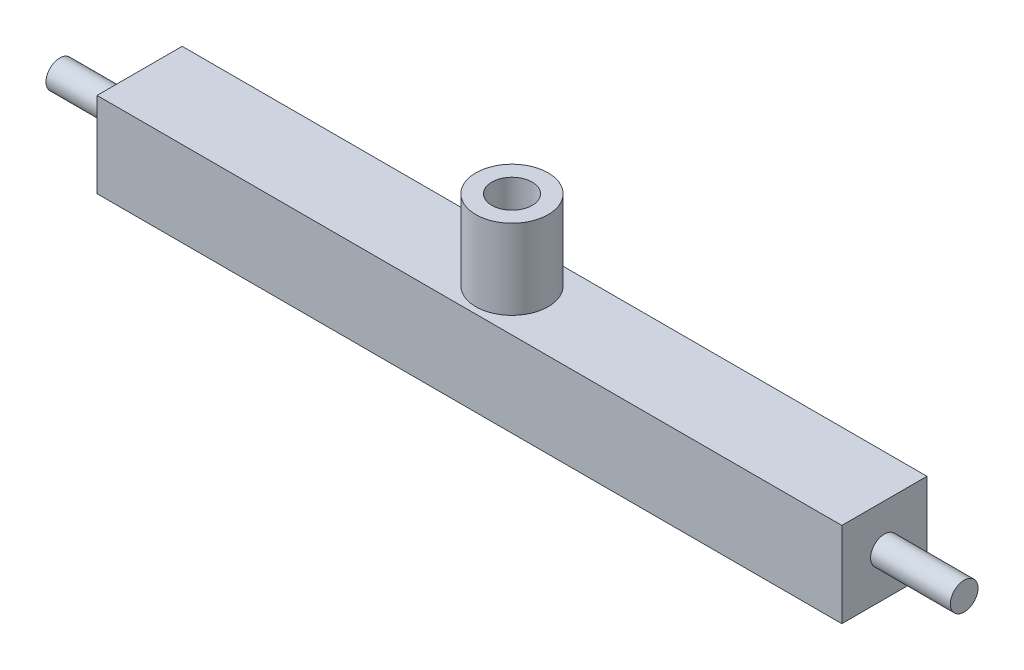
from build123d import *

# Parameters (mm, degrees)
SKETCH1_W           = 10.16
SKETCH1_H           = 10.16
BOSS_EXTRUDE1_DEPTH = 88.9
SKETCH2_R           = 1.651
BOSS_EXTRUDE2_DEPTH = 9.525
SKETCH3_R           = 4.318
BOSS_EXTRUDE3_DEPTH = 9.525
SKETCH4_R           = 2.413
CUT_EXTRUDE1_DEPTH  = 6.35


with BuildPart() as part:
    # Sketch1 → Boss-Extrude1 (new body)
    with BuildSketch(Plane(origin=(0, 0, 0), x_dir=(0, 0, -1), z_dir=(1, 0, 0))):
        with Locations((5.08, 5.08)):
            Rectangle(SKETCH1_W, SKETCH1_H)
    extrude(amount=BOSS_EXTRUDE1_DEPTH)

    # Sketch2 → Boss-Extrude2 (add)
    with BuildSketch(Plane(origin=(88.9, 0, 0), x_dir=(0, 0, -1), z_dir=(1, 0, 0))):
        with Locations((5.08, 5.08)):
            Circle(SKETCH2_R)
    boss_extrude2 = extrude(amount=BOSS_EXTRUDE2_DEPTH)

    # Mirror1: Boss-Extrude2 across plane
    add(boss_extrude2.mirror(Plane(origin=(44.45, 0, 0), x_dir=(0, 0, 1), z_dir=(1, 0, 0))))

    # Sketch3 → Boss-Extrude3 (add)
    with BuildSketch(Plane(origin=(0, 10.16, 0), x_dir=(1, 0, 0), z_dir=(0, 1, 0))):
        with Locations((44.45, 5.08)):
            Circle(SKETCH3_R)
    extrude(amount=BOSS_EXTRUDE3_DEPTH)

    # Sketch4 → Cut-Extrude1 (cut)
    with BuildSketch(Plane(origin=(0, 19.685, 0), x_dir=(1, 0, 0), z_dir=(0, 1, 0))):
        with Locations((44.45, 5.08)):
            Circle(SKETCH4_R)
    extrude(amount=-CUT_EXTRUDE1_DEPTH, mode=Mode.SUBTRACT)


solid = part.part
